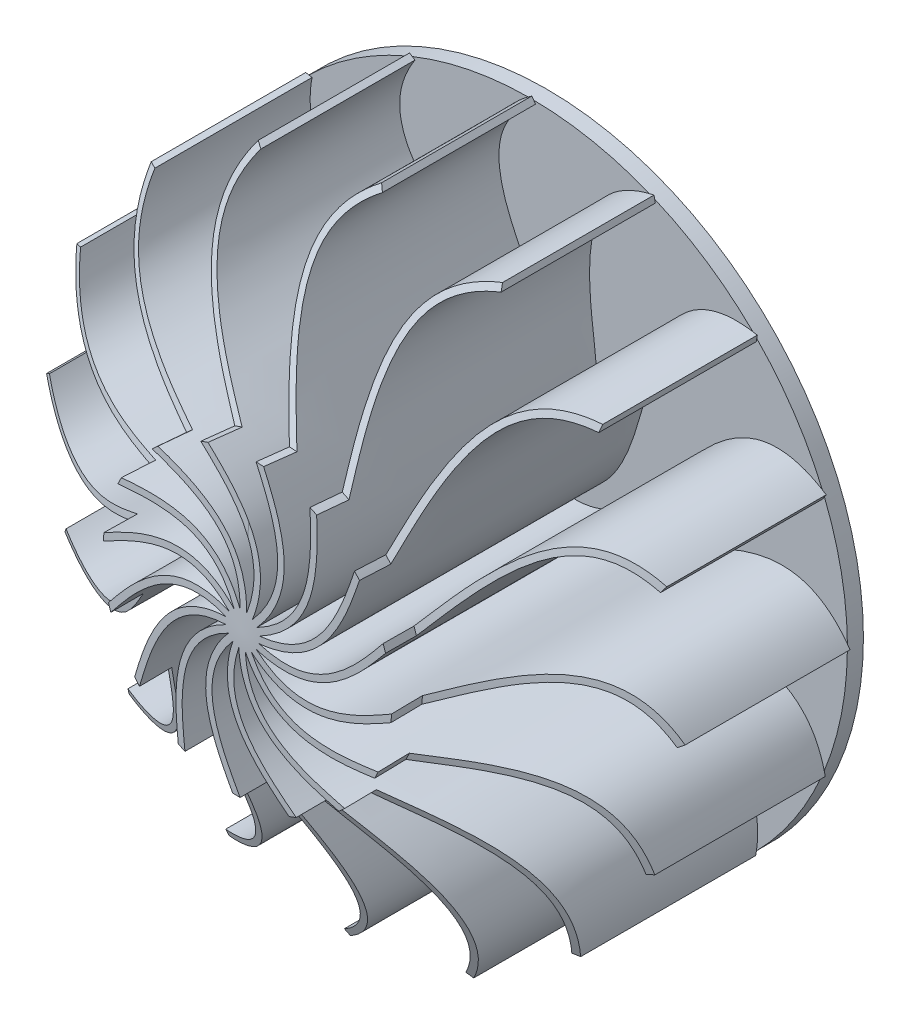
from build123d import *

# Parameters (mm, degrees)
SKETCH2_R           = 197.5
BOSS_EXTRUDE1_DEPTH = 10
EXTRUDE_THIN1_DEPTH = 180
CIRPATTERN1_COUNT   = 16
SKETCH10_R          = 10
CUT_EXTRUDE1_DEPTH  = 5


# Read off the part's stored shape, not the designer's step: Extrude-Thin1
with BuildPart() as part:
    # Sketch2 → Boss-Extrude1 (new body)
    with BuildSketch(Plane.XY):
        Circle(SKETCH2_R)
    extrude(amount=BOSS_EXTRUDE1_DEPTH)

    # Extrude-Thin1 outline → Extrude-Thin1 (add)
    with BuildSketch(Plane.XY.offset(10)):
        with BuildLine():
            Line((1.99623327, -0.122689569), (-1.99623327, 0.122689569))
            add(Edge.make_bspline(
                [(-1.99623327, 0.122689569), (-2.394820565, -6.362566092), (-2.098048687, -12.219503672), (-0.275680364, -22.826782032), (1.251418674, -27.576627299), (5.351405176, -36.08520186), (7.923531689, -39.84172735), (13.883762035, -46.489987372), (17.270167584, -49.382233868), (24.632601297, -54.476788829), (28.608881588, -56.680193597), (36.954166992, -60.584904673), (41.322006897, -62.284688182), (54.749985185, -66.914095549), (64.146130004, -69.385348811), (75.69285018, -72.706102786), (77.991782034, -73.381768198), (82.552701242, -74.779299648), (84.814793339, -75.500397747), (91.514313237, -77.748918588), (95.864984361, -79.361742555), (104.165432984, -82.908810317), (108.115003373, -84.843113463), (115.445809099, -89.12061261), (118.826581997, -91.463546724), (124.864445964, -96.640699169), (127.521476682, -99.47383821), (131.98060292, -105.727600081), (133.78438712, -109.147986366), (136.40835781, -116.71614245), (137.228988238, -120.866076113), (137.71323181, -130.04653057), (137.37536526, -135.077371364), (136.360612886, -140.605892932)],
                knots=[0, 0, 0, 0, 0.0625, 0.0625, 0.125, 0.125, 0.1875, 0.1875, 0.25, 0.25, 0.3125, 0.3125, 0.375, 0.375, 0.5, 0.5, 0.53125, 0.53125, 0.5625, 0.5625, 0.625, 0.625, 0.6875, 0.6875, 0.75, 0.75, 0.8125, 0.8125, 0.875, 0.875, 0.9375, 0.9375, 1, 1, 1, 1], degree=3))
            Line((136.360612886, -140.605892932), (140.294888814, -141.328023756))
            add(Edge.make_bspline(
                [(1.99623327, -0.122689569), (1.614148453, -6.339439969), (1.902864154, -11.883708581), (3.607891919, -21.807994407), (5.022701388, -26.188507133), (8.787054377, -34.000551897), (11.137358847, -37.43428774), (16.626614486, -43.557205261), (19.76726394, -46.245874975), (26.687665798, -51.034558852), (30.467166077, -53.133476712), (38.486268922, -56.885568844), (42.72289288, -58.536611345), (55.859399212, -63.065531327), (65.193381906, -65.52439758), (76.812986354, -68.86611255), (79.135090395, -69.5485269), (83.753148956, -70.963566671), (86.048749052, -71.695266235), (92.86458224, -73.982824628), (97.313848518, -75.630968476), (105.860233841, -79.283133465), (109.957559995, -81.287095253), (117.635061613, -85.766890224), (121.215699517, -88.242985294), (127.682726529, -93.788122596), (130.569175989, -96.858244119), (135.446634603, -103.698701886), (137.435955076, -107.469274676), (140.315373344, -115.774202383), (141.205027202, -120.306393438), (141.726086933, -130.184821187), (141.358972499, -135.530737883), (140.294888814, -141.328023756)],
                knots=[0, 0, 0, 0, 0.0625, 0.0625, 0.125, 0.125, 0.1875, 0.1875, 0.25, 0.25, 0.3125, 0.3125, 0.375, 0.375, 0.5, 0.5, 0.53125, 0.53125, 0.5625, 0.5625, 0.625, 0.625, 0.6875, 0.6875, 0.75, 0.75, 0.8125, 0.8125, 0.875, 0.875, 0.9375, 0.9375, 1, 1, 1, 1], degree=3))
        make_face()
    extrude_thin1 = extrude(amount=EXTRUDE_THIN1_DEPTH)

    # CirPattern1: Extrude-Thin1 ×16 about axis
    cirpattern1_axis = Axis((0, 0, 10), (0, 0, 1))
    for i in range(1, CIRPATTERN1_COUNT):
        add(extrude_thin1.rotate(cirpattern1_axis, i * 360 / CIRPATTERN1_COUNT))

    # Sketch9 → Cut-Revolve2 (revolve, cut)
    with BuildSketch(Plane(origin=(0, 0, 0), x_dir=(0, 0, -1), z_dir=(1, 0, 0)), mode=Mode.PRIVATE) as cut_revolve2_sk:
        Polygon((-190, -0.730536724), (-210, 0), (-210, -276.340814246), (-87.360980159, -276.340814246), (-170, -90.730536724), (-190, -90.730536724), align=None)
    revolve(cut_revolve2_sk.sketch.rotate(Axis((0, -0.730536724, 190), (0, 0.03650249332489155, 0.9993335619206763)), 180), axis=Axis((0, -0.730536724, 190), (0, 0.03650249332489155, 0.9993335619206763)), mode=Mode.SUBTRACT)

    # Sketch10 → Cut-Extrude1 (cut)
    with BuildSketch(Plane(origin=(0, 0, 0), x_dir=(-1, 0, 0), z_dir=(0, 0, -1))):
        Circle(SKETCH10_R)
    extrude(amount=-CUT_EXTRUDE1_DEPTH, mode=Mode.SUBTRACT)


solid = part.part
